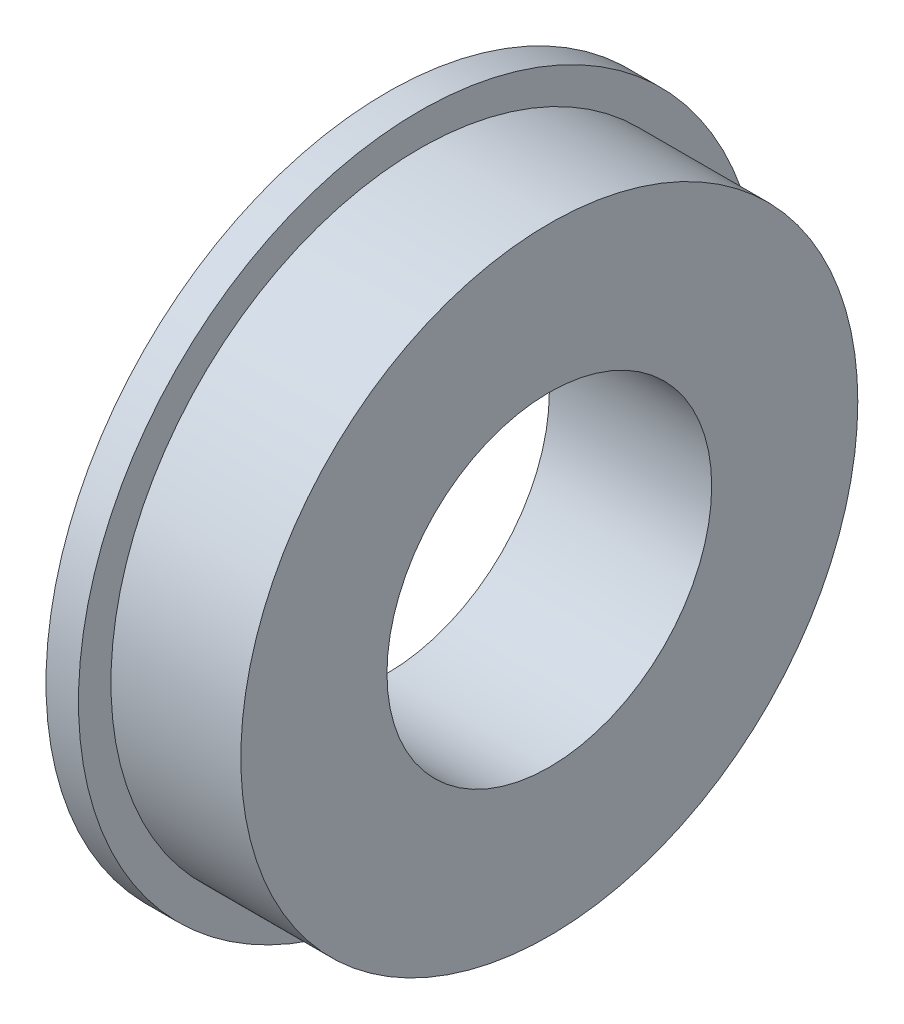
from build123d import *

# Parameters (mm, degrees)
SKETCH1_R           = 9.5
SKETCH1_R_2         = 5
BOSS_EXTRUDE1_DEPTH = 5
SKETCH1_3_R         = 10.5
SKETCH1_3_R_2       = 9.5
BOSS_EXTRUDE2_DEPTH = 1


with BuildPart() as part:
    # Sketch1 → Boss-Extrude1 (new body)
    with BuildSketch(Plane(origin=(0, 0, 0), x_dir=(0, 0, -1), z_dir=(1, 0, 0))):
        Circle(SKETCH1_R)
        Circle(SKETCH1_R_2, mode=Mode.SUBTRACT)
    extrude(amount=BOSS_EXTRUDE1_DEPTH)

    # Sketch1<3> → Boss-Extrude2 (add)
    with BuildSketch(Plane(origin=(0, 0, 0), x_dir=(0, 0, -1), z_dir=(1, 0, 0))):
        Circle(SKETCH1_3_R)
        Circle(SKETCH1_3_R_2, mode=Mode.SUBTRACT)
    extrude(amount=BOSS_EXTRUDE2_DEPTH)


solid = part.part
